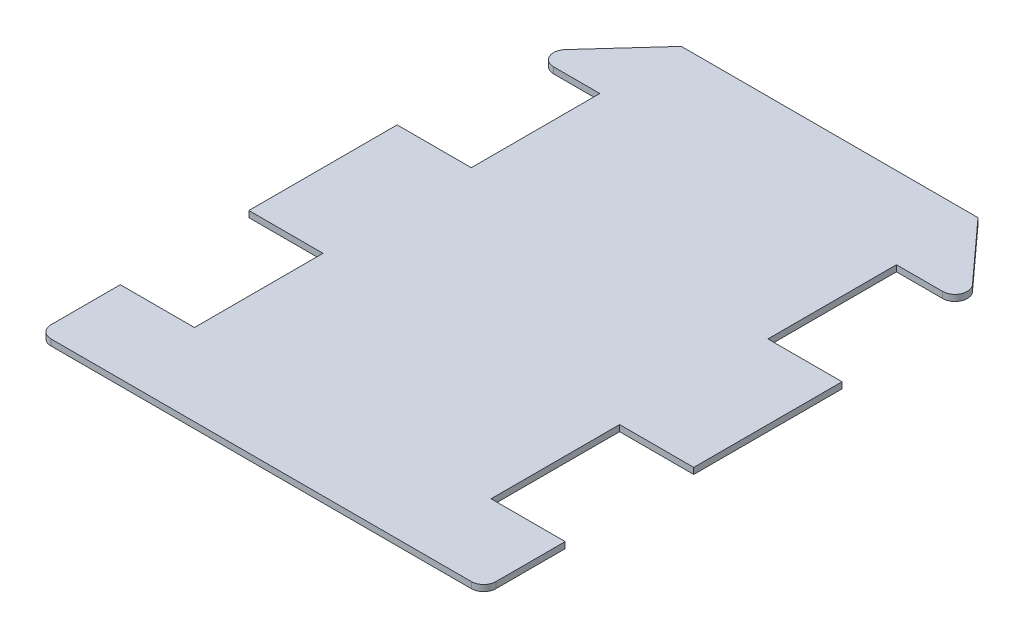
from build123d import *

# Parameters (mm, degrees)
BOSS_EXTRUDE1_DEPTH = 2.5
FILLET1_R           = 5
FILLET2_R           = 5


with BuildPart() as part:
    # Sketch1 → Boss-Extrude1 (new body)
    with BuildSketch(Plane(origin=(0, 0, 0), x_dir=(1, 0, 0), z_dir=(0, 1, 0))):
        Polygon((0, 0), (0, 60), (30, 60), (30, 112), (0, 112), (30, 145), (150, 145), (180, 112), (150, 112), (150, 60), (180, 60), (180, 0), (150, 0), (150, -52), (180, -52), (180, -85), (0, -85), (0, -52), (30, -52), (30, 0), align=None)
    extrude(amount=BOSS_EXTRUDE1_DEPTH)

    # Fillet1
    fillet1_edges = [part.edges().sort_by_distance(p)[0] for p in [
        (180, 1.25, 85),
        (0, 1.25, 85),
    ]]
    fillet(fillet1_edges, radius=FILLET1_R)

    # Fillet2
    fillet2_edges = [part.edges().sort_by_distance(p)[0] for p in [
        (0, 1.25, -112),
        (180, 1.25, -112),
    ]]
    fillet(fillet2_edges, radius=FILLET2_R)


solid = part.part
